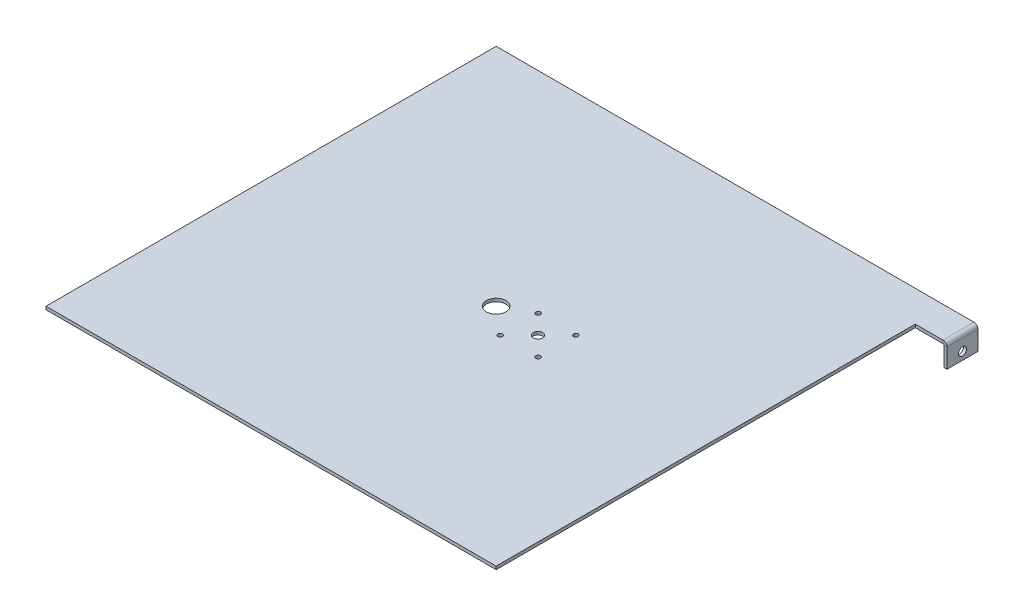
from build123d import *

# Parameters (mm, degrees)
BASE_FLANGE1_DEPTH           = 2.54
SKETCH6_R                    = 3.81
SKETCH6_R_2                  = 1.905
CUT_EXTRUDE1_DEPTH           = 2.54
SKETCH7_R                    = 8
CUT_EXTRUDE2_DEPTH           = 2.54
EDGE_FLANGE1_STRIP_W         = 11.6332
EDGE_FLANGE1_STRIP_H         = 2.54
EDGE_FLANGE1_STRIP_CUT_DEPTH = 25.4
EDGE_FLANGE1_DEPTH           = 25.4
SKETCH12_R                   = 3.302
CUT_EXTRUDE3_DEPTH           = 2.54


# Sheet-metal steps are written as plain solids
with BuildPart() as part:
    # Sketch1 → Base-Flange1 (new body)
    with BuildSketch(Plane(origin=(0, 0, 0), x_dir=(1, 0, 0), z_dir=(0, 1, 0))):
        Polygon((0, 0), (368.3, 0), (368.3, 342.9), (394.208, 342.9), (394.208, 368.3), (368.3, 368.3), (0, 368.3), align=None)
    extrude(amount=-BASE_FLANGE1_DEPTH)

    # Sketch6 → Cut-Extrude1 (cut)
    with BuildSketch(Plane(origin=(0, 0, 0), x_dir=(1, 0, 0), z_dir=(0, 1, 0))):
        with Locations(Location((221.844041513, 180.737580342, 0), (0, 0, 270))):
            Circle(SKETCH6_R)
        with Locations(Location((237.338041513, 165.243580342, 0), (0, 0, 270))):
            Circle(SKETCH6_R_2)
        with Locations(Location((237.338041513, 196.231580342, 0), (0, 0, 270))):
            Circle(SKETCH6_R_2)
        with Locations(Location((206.350041513, 196.231580342, 0), (0, 0, 270))):
            Circle(SKETCH6_R_2)
        with Locations(Location((206.350041513, 165.243580342, 0), (0, 0, 270))):
            Circle(SKETCH6_R_2)
    extrude(amount=-CUT_EXTRUDE1_DEPTH, mode=Mode.SUBTRACT)

    # Sketch7 → Cut-Extrude2 (cut)
    with BuildSketch(Plane(origin=(0, -2.54, 0), x_dir=(-1, 0, 0), z_dir=(0, -1, 0))):
        with Locations(Location((-184.15, 184.15, 0), (0, 0, 90))):
            Circle(SKETCH7_R)
    extrude(amount=-CUT_EXTRUDE2_DEPTH, mode=Mode.SUBTRACT)

    # Edge-Flange1 strip (across the edge) → Edge-Flange1 strip cut (cut)
    with BuildSketch(Plane(origin=(394.208, -2.54, -368.3), x_dir=(-1, 0, 0), z_dir=(0, 0, 1))):
        with Locations((-2.54, -1.27)):
            Rectangle(EDGE_FLANGE1_STRIP_W, EDGE_FLANGE1_STRIP_H)
    extrude(amount=EDGE_FLANGE1_STRIP_CUT_DEPTH, mode=Mode.SUBTRACT)

    # Edge-Flange1 section (across the edge) → Edge-Flange1 (add)
    with BuildSketch(Plane(origin=(394.208, -2.54, -368.3), x_dir=(-1, 0, 0), z_dir=(0, 0, 1))):
        with BuildLine():
            Line((0, 0.7366), (0, 16.51))
            Line((0, 16.51), (2.54, 16.51))
            Line((2.54, 16.51), (2.54, 0.7366))
            ThreePointArc((2.54, 0.7366), (2.755745145, 0.215745145), (3.2766, 0))
            Line((3.2766, 0), (3.2766, -2.54))
            ThreePointArc((3.2766, -2.54), (0.959693921, -1.580306079), (0, 0.7366))
        make_face()
    extrude(amount=EDGE_FLANGE1_DEPTH)

    # Sketch12 → Cut-Extrude3 (cut)
    with BuildSketch(Plane(origin=(394.208, 0, 0), x_dir=(0, 0, -1), z_dir=(1, 0, 0))):
        with Locations(Location((355.6, -12.7, 0), (0, 0, 90))):
            Circle(SKETCH12_R)
    extrude(amount=-CUT_EXTRUDE3_DEPTH, mode=Mode.SUBTRACT)


solid = part.part
